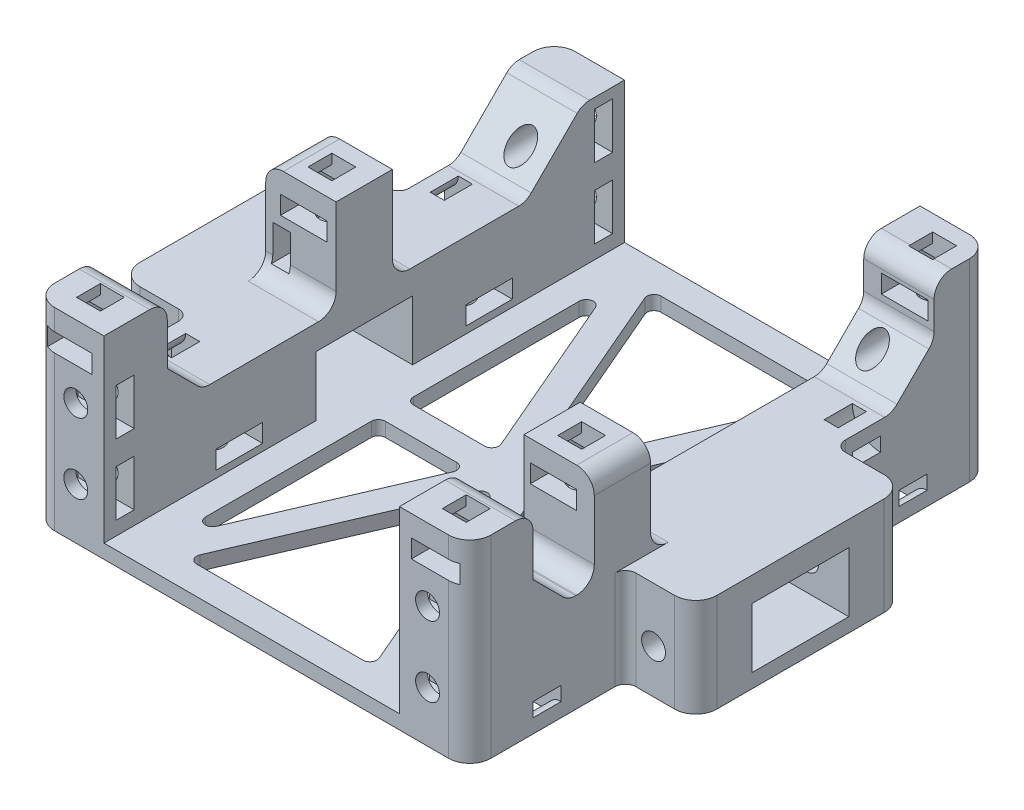
from build123d import *

# Parameters (mm, degrees)
SKETCH1_W                = 75
SKETCH1_H                = 74
BOSS_EXTRUDE1_DEPTH      = 4
BOSS_EXTRUDE2_DEPTH      = 10
SKETCH4_W                = 21
SKETCH4_H                = 37
CUT_EXTRUDE1_DEPTH       = 2
SKETCH6_R                = 1.7
CUT_EXTRUDE2_DEPTH       = 13
SKETCH8_W                = 2.6
SKETCH8_H                = 6.6
CUT_EXTRUDE4_DEPTH       = 8
MIRROR2_COPY_1_DEPTH     = 10
MIRROR2_COPY_2_SKETCH_W  = 21
MIRROR2_COPY_2_SKETCH_H  = 37
MIRROR2_COPY_2_DEPTH     = 2
BOSS_EXTRUDE3_DEPTH      = 10
BOSS_EXTRUDE3_DEPTH_BACK = 4
SKETCH10_W               = 10
SKETCH10_H               = 8
BOSS_EXTRUDE4_DEPTH      = 27.5
MIRROR4_COPY_1_SKETCH_R  = 1.7
MIRROR4_COPY_1_DEPTH     = 13
MIRROR4_COPY_2_SKETCH_W  = 2.6
MIRROR4_COPY_2_SKETCH_H  = 6.6
MIRROR4_COPY_2_DEPTH     = 8
SKETCH11_R               = 1.7
CUT_EXTRUDE5_DEPTH       = 7
CUT_EXTRUDE6_DEPTH       = 5
CUT_EXTRUDE6_DEPTH_BACK  = 8
SKETCH12_W               = 6.6
SKETCH12_H               = 2.6
SKETCH13_W               = 6.6
SKETCH13_H               = 2.6
CUT_EXTRUDE7_DEPTH       = 8
SKETCH14_W               = 6.6
SKETCH14_H               = 2.6
CUT_EXTRUDE8_DEPTH       = 8
BOSS_EXTRUDE5_DEPTH      = 6
BOSS_EXTRUDE6_DEPTH      = 6
CUT_EXTRUDE9_DEPTH       = 60.426425099
CUT_EXTRUDE9_DEPTH_BACK  = 60.426425099
SKETCH15_W               = 13.75
SKETCH15_H               = 8.5
CUT_EXTRUDE10_DEPTH      = 60.426425099
CUT_EXTRUDE10_DEPTH_BACK = 60.426425099
SKETCH18_W               = 5.5
SKETCH18_H               = 4
SKETCH18_W_2             = 7.5
SKETCH19_R               = 1.7
CUT_EXTRUDE11_DEPTH      = 8
SKETCH20_W               = 6.6
SKETCH20_H               = 2.6
CUT_EXTRUDE12_DEPTH      = 8
BOSS_EXTRUDE7_DEPTH      = 10
SKETCH23_R               = 1.7
CUT_EXTRUDE14_DEPTH      = 72.044110417
SKETCH22_W               = 7
SKETCH22_H               = 3
CUT_EXTRUDE13_DEPTH      = 11
CUT_EXTRUDE15_REACH      = 63.508
BOSS_EXTRUDE8_START      = -32
BOSS_EXTRUDE8_DEPTH      = 10
CUT_EXTRUDE16_REACH      = 91.422
SKETCH26_W               = 6.6
SKETCH26_H               = 2.6
SKETCH27_R               = 1.7
CUT_EXTRUDE17_DEPTH      = 7
CUT_EXTRUDE19_REACH      = 66.817
SKETCH29_W               = 2.5
SKETCH29_H               = 5
FILLET1_R                = 1
FILLET2_R                = 3
FILLET3_R                = 1.5
FILLET4_R                = 2.5
SKETCH28_W               = 3.4
SKETCH28_H               = 3.4
CUT_EXTRUDE18_DEPTH      = 5.6
CHAMFER1_SIZE            = 1.6
SKETCH30_W               = 2
SKETCH30_H               = 4
SKETCH31_W               = 4
SKETCH31_H               = 2
SKETCH33_W               = 4
SKETCH33_H               = 2
MIRROR8_COPY_1_SKETCH_W  = 2
MIRROR8_COPY_1_SKETCH_H  = 4


# Read off the part's stored shape, not the designer's step: Boss-Extrude8
# Some blends are built 0.0001 mm under size
with BuildPart() as part:
    # Sketch1 → Boss-Extrude1 (new body)
    with BuildSketch(Plane(origin=(0, 0, 0), x_dir=(1, 0, 0), z_dir=(0, 1, 0))):
        Rectangle(SKETCH1_W, SKETCH1_H)
    extrude(amount=BOSS_EXTRUDE1_DEPTH)

    # Sketch2 → Boss-Extrude2 (add)
    with BuildSketch(Plane(origin=(20, 0, 0), x_dir=(0, 0, -1), z_dir=(1, 0, 0))):
        Polygon((-37, 4), (-37, 22), (-31, 22), (-13, 4), align=None)
    boss_extrude2 = extrude(amount=BOSS_EXTRUDE2_DEPTH)

    # Sketch4 → Cut-Extrude1 (cut)
    with BuildSketch(Plane(origin=(0, 4, 0), x_dir=(1, 0, 0), z_dir=(0, 1, 0))):
        with Locations((9.5, -18.5)):
            Rectangle(SKETCH4_W, SKETCH4_H)
    cut_extrude1 = extrude(amount=-CUT_EXTRUDE1_DEPTH, mode=Mode.SUBTRACT)

    # Sketch6 → Cut-Extrude2 (cut)
    with BuildSketch(Plane.XY.offset(37)):
        with Locations((24, 7.25)):
            Circle(SKETCH6_R)
        with Locations((24, 17.25)):
            Circle(SKETCH6_R)
    cut_extrude2 = extrude(amount=-CUT_EXTRUDE2_DEPTH, mode=Mode.SUBTRACT)

    # Sketch8 → Cut-Extrude4 (cut)
    with BuildSketch(Plane.ZY.offset(-20)):
        with Locations((34, 17.25)):
            Rectangle(SKETCH8_W, SKETCH8_H)
        with Locations((34, 7.25)):
            Rectangle(SKETCH8_W, SKETCH8_H)
    cut_extrude4 = extrude(amount=-CUT_EXTRUDE4_DEPTH, mode=Mode.SUBTRACT)

    # Mirror1: Boss-Extrude2, Cut-Extrude1 across plane
    add(boss_extrude2.mirror(Plane(origin=(-1, 0, 0), x_dir=(0, 0, 1), z_dir=(1, 0, 0))))
    add(cut_extrude1.mirror(Plane(origin=(-1, 0, 0), x_dir=(0, 0, 1), z_dir=(1, 0, 0))), mode=Mode.SUBTRACT)

    # Mirror2: Boss-Extrude2, Cut-Extrude1 across plane
    add(boss_extrude2.mirror(Plane.XY))
    add(cut_extrude1.mirror(Plane.XY), mode=Mode.SUBTRACT)

    # Mirror2 copy 1 sketch → Mirror2 copy 1 (add)
    with BuildSketch(Plane.ZY.offset(22)):
        Polygon((-37, 4), (-37, 22), (-31, 22), (-13, 4), align=None)
    extrude(amount=MIRROR2_COPY_1_DEPTH)

    # Mirror2 copy 2 sketch → Mirror2 copy 2 (cut)
    with BuildSketch(Plane(origin=(-2, 4, 0), x_dir=(-1, 0, 0), z_dir=(0, 1, 0))):
        with Locations((9.5, -18.5)):
            Rectangle(MIRROR2_COPY_2_SKETCH_W, MIRROR2_COPY_2_SKETCH_H)
    extrude(amount=-MIRROR2_COPY_2_DEPTH, mode=Mode.SUBTRACT)

    # Sketch9 → Boss-Extrude3 (add, two sides: drawn at the far end of the back side and taken through both)
    with BuildSketch(Plane(origin=(0, 4, 0), x_dir=(1, 0, 0), z_dir=(0, 1, 0)).offset(-BOSS_EXTRUDE3_DEPTH_BACK)):
        Polygon((-22, -23), (-22, -2), (-22, 2), (-22, 23), (-26, 23), (-26, -23), align=None)
        Polygon((24, 2), (24, 23), (20, 23), (20, 2), (20, -2), (20, -23), (24, -23), (24, -2), align=None)
    extrude(amount=BOSS_EXTRUDE3_DEPTH + BOSS_EXTRUDE3_DEPTH_BACK)

    # Sketch10 → Boss-Extrude4 (add)
    with BuildSketch(Plane(origin=(0, 0, 0), x_dir=(-1, 0, 0), z_dir=(0, -1, 0))):
        Polygon((31.2, 4), (22, 4), (22, -4), (31.2, -4), (32, -4), (32, 4), align=None)
        with Locations((-25, -15.3)):
            Rectangle(SKETCH10_W, SKETCH10_H)
        with Locations((-25, 33)):
            Rectangle(SKETCH10_W, SKETCH10_H)
    extrude(amount=-BOSS_EXTRUDE4_DEPTH)

    # Mirror3: Cut-Extrude2, Cut-Extrude4 across plane
    add(cut_extrude2.mirror(Plane(origin=(-1, 0, 0), x_dir=(0, 0, 1), z_dir=(1, 0, 0))), mode=Mode.SUBTRACT)
    add(cut_extrude4.mirror(Plane(origin=(-1, 0, 0), x_dir=(0, 0, 1), z_dir=(1, 0, 0))), mode=Mode.SUBTRACT)

    # Mirror4: Cut-Extrude2, Cut-Extrude4 across plane
    add(cut_extrude2.mirror(Plane.XY), mode=Mode.SUBTRACT)
    add(cut_extrude4.mirror(Plane.XY), mode=Mode.SUBTRACT)

    # Mirror4 copy 1 sketch → Mirror4 copy 1 (cut)
    with BuildSketch(Plane(origin=(-2, 0, -37), x_dir=(-1, 0, 0), z_dir=(0, 0, -1))):
        with Locations((24, 7.25)):
            Circle(MIRROR4_COPY_1_SKETCH_R)
        with Locations((24, 17.25)):
            Circle(MIRROR4_COPY_1_SKETCH_R)
    extrude(amount=-MIRROR4_COPY_1_DEPTH, mode=Mode.SUBTRACT)

    # Mirror4 copy 2 sketch → Mirror4 copy 2 (cut)
    with BuildSketch(Plane(origin=(-22, 0, 0), x_dir=(0, 0, -1), z_dir=(1, 0, 0))):
        with Locations((34, 17.25)):
            Rectangle(MIRROR4_COPY_2_SKETCH_W, MIRROR4_COPY_2_SKETCH_H)
        with Locations((34, 7.25)):
            Rectangle(MIRROR4_COPY_2_SKETCH_W, MIRROR4_COPY_2_SKETCH_H)
    extrude(amount=-MIRROR4_COPY_2_DEPTH, mode=Mode.SUBTRACT)

    # Sketch11 → Cut-Extrude5 (cut)
    with BuildSketch(Plane(origin=(0, 27.5, 0), x_dir=(1, 0, 0), z_dir=(0, 1, 0))):
        with Locations(Location((-26.6, 0, 0), (0, 0, 270))):
            Circle(SKETCH11_R)
        with Locations(Location((25.8, 33, 0), (0, 0, 270))):
            Circle(SKETCH11_R)
        with Locations(Location((24.2, -15.3, 0), (0, 0, 270))):
            Circle(SKETCH11_R)
    extrude(amount=-CUT_EXTRUDE5_DEPTH, mode=Mode.SUBTRACT)

    # Sketch12 → Cut-Extrude6 (cut, two sides: drawn at the far end of the back side and taken through both)
    with BuildSketch(Plane.XY.offset(-29).offset(-CUT_EXTRUDE6_DEPTH_BACK)):
        with Locations((25.8, 23.2)):
            Rectangle(SKETCH12_W, SKETCH12_H)
    extrude(amount=CUT_EXTRUDE6_DEPTH + CUT_EXTRUDE6_DEPTH_BACK, mode=Mode.SUBTRACT)

    # Sketch13 → Cut-Extrude7 (cut)
    with BuildSketch(Plane(origin=(0, 0, 11.3), x_dir=(-1, 0, 0), z_dir=(0, 0, -1))):
        with Locations((-24.2, 23.2)):
            Rectangle(SKETCH13_W, SKETCH13_H)
    extrude(amount=-CUT_EXTRUDE7_DEPTH, mode=Mode.SUBTRACT)

    # Sketch14 → Cut-Extrude8 (cut)
    with BuildSketch(Plane(origin=(0, 0, -4), x_dir=(-1, 0, 0), z_dir=(0, 0, -1))):
        with Locations((26.6, 23.2)):
            Rectangle(SKETCH14_W, SKETCH14_H)
    extrude(amount=-CUT_EXTRUDE8_DEPTH, mode=Mode.SUBTRACT)

    # Sketch16 → Boss-Extrude5 (add)
    with BuildSketch(Plane.ZY.offset(26)):
        Polygon((-23, 14), (-13, 4), (13, 4), (23, 14), align=None)
    extrude(amount=BOSS_EXTRUDE5_DEPTH)

    # Sketch17 → Boss-Extrude6 (add)
    with BuildSketch(Plane(origin=(24, 0, 0), x_dir=(0, 0, -1), z_dir=(1, 0, 0))):
        Polygon((-23, 14), (-13, 4), (13, 4), (23, 14), align=None)
    extrude(amount=BOSS_EXTRUDE6_DEPTH)

    # Sketch15 → Cut-Extrude9 (cut, two sides: drawn at the far end of the back side and taken through both)
    with BuildSketch(Plane(origin=(0, 0, 0), x_dir=(0, 0, -1), z_dir=(1, 0, 0)).offset(-CUT_EXTRUDE9_DEPTH_BACK)):
        with Locations((0, 6.25)):
            Rectangle(SKETCH15_W, SKETCH15_H)
    extrude(amount=CUT_EXTRUDE9_DEPTH + CUT_EXTRUDE9_DEPTH_BACK, mode=Mode.SUBTRACT)

    # Sketch18 → Cut-Extrude10 (cut, two sides: drawn at the far end of the back side and taken through both)
    with BuildSketch(Plane.XY.offset(-CUT_EXTRUDE10_DEPTH_BACK)):
        with Locations((-34.75, 2)):
            Rectangle(SKETCH18_W, SKETCH18_H)
        with Locations((33.75, 2)):
            Rectangle(SKETCH18_W_2, SKETCH18_H)
    extrude(amount=CUT_EXTRUDE10_DEPTH + CUT_EXTRUDE10_DEPTH_BACK, mode=Mode.SUBTRACT)

    # Sketch19 → Cut-Extrude11 (cut)
    with BuildSketch(Plane.XZ):
        with Locations(Location((-26, 17.75, 0), (0, 0, 270))):
            Circle(SKETCH19_R)
        with Locations(Location((-26, -17.75, 0), (0, 0, 90))):
            Circle(SKETCH19_R)
    extrude(amount=-CUT_EXTRUDE11_DEPTH, mode=Mode.SUBTRACT)

    # Sketch20 → Cut-Extrude12 (cut)
    with BuildSketch(Plane(origin=(-22, 0, 0), x_dir=(0, 0, -1), z_dir=(1, 0, 0))):
        with Locations((-17.75, 4.3)):
            Rectangle(SKETCH20_W, SKETCH20_H)
        with Locations((17.75, 4.3)):
            Rectangle(SKETCH20_W, SKETCH20_H)
    extrude(amount=-CUT_EXTRUDE12_DEPTH, mode=Mode.SUBTRACT)

    # Sketch21 → Boss-Extrude7 (add)
    with BuildSketch(Plane(origin=(30, 0, 0), x_dir=(0, 0, -1), z_dir=(1, 0, 0))):
        Polygon((-14.875, 0), (0, 0), (0, 2), (-6.875, 2), (-6.875, 10.5), (0, 10.5), (0, 14), (-11.3, 14), (-14.875, 14), align=None)
        Polygon((0, 2), (0, 0), (14.875, 0), (14.875, 14), (11.3, 14), (0, 14), (0, 10.5), (6.875, 10.5), (6.875, 2), align=None)
    boss_extrude7 = extrude(amount=BOSS_EXTRUDE7_DEPTH)

    # Sketch23 → Cut-Extrude14 (cut, through all)
    with BuildSketch(Plane(origin=(0, 0, -14.875), x_dir=(-1, 0, 0), z_dir=(0, 0, -1))):
        with Locations(Location((-34, 6.25, 0), (0, 0, 90))):
            Circle(SKETCH23_R)
    cut_extrude14 = extrude(amount=-CUT_EXTRUDE14_DEPTH, mode=Mode.SUBTRACT)

    # Sketch22 → Cut-Extrude13 (cut)
    with BuildSketch(Plane.XZ):
        with Locations((34, 10.875)):
            Rectangle(SKETCH22_W, SKETCH22_H)
        with Locations((34, -10.875)):
            Rectangle(SKETCH22_W, SKETCH22_H)
    cut_extrude13 = extrude(amount=-CUT_EXTRUDE13_DEPTH, mode=Mode.SUBTRACT)

    # Mirror5: Boss-Extrude7, Cut-Extrude14, Cut-Extrude13 across plane
    add(boss_extrude7.mirror(Plane(origin=(-1, 0, 0), x_dir=(0, 0, 1), z_dir=(1, 0, 0))))
    add(cut_extrude14.mirror(Plane(origin=(-1, 0, 0), x_dir=(0, 0, 1), z_dir=(1, 0, 0))), mode=Mode.SUBTRACT)
    add(cut_extrude13.mirror(Plane(origin=(-1, 0, 0), x_dir=(0, 0, 1), z_dir=(1, 0, 0))), mode=Mode.SUBTRACT)

    # Sketch24 → Cut-Extrude15 (cut, up to next)
    with BuildSketch(Plane(origin=(0, 2, 0), x_dir=(1, 0, 0), z_dir=(0, 1, 0)), mode=Mode.PRIVATE) as cut_extrude15_sk1:
        Polygon((-18, 2), (-18, 31.420377933), (-5.353875425, 2), align=None)
    cut_extrude15_tool1 = extrude(cut_extrude15_sk1.sketch, amount=-CUT_EXTRUDE15_REACH, mode=Mode.PRIVATE) & part.part
    # Sketch24 → Cut-Extrude15 (cut, up to next)
    with BuildSketch(Plane(origin=(0, 2, 0), x_dir=(1, 0, 0), z_dir=(0, 1, 0)), mode=Mode.PRIVATE) as cut_extrude15_sk2:
        Polygon((-14.325113046, 33), (-1, 2), (12.325113046, 33), align=None)
    cut_extrude15_tool2 = extrude(cut_extrude15_sk2.sketch, amount=-CUT_EXTRUDE15_REACH, mode=Mode.PRIVATE) & part.part
    # Sketch24 → Cut-Extrude15 (cut, up to next)
    with BuildSketch(Plane(origin=(0, 2, 0), x_dir=(1, 0, 0), z_dir=(0, 1, 0)), mode=Mode.PRIVATE) as cut_extrude15_sk3:
        Polygon((16, 2), (3.353875425, 2), (16, 31.420377933), align=None)
    cut_extrude15_tool3 = extrude(cut_extrude15_sk3.sketch, amount=-CUT_EXTRUDE15_REACH, mode=Mode.PRIVATE) & part.part
    # Sketch24 → Cut-Extrude15 (cut, up to next)
    with BuildSketch(Plane(origin=(0, 2, 0), x_dir=(1, 0, 0), z_dir=(0, 1, 0)), mode=Mode.PRIVATE) as cut_extrude15_sk4:
        Polygon((16, -2), (16, -31.420377933), (3.353875425, -2), align=None)
    cut_extrude15_tool4 = extrude(cut_extrude15_sk4.sketch, amount=-CUT_EXTRUDE15_REACH, mode=Mode.PRIVATE) & part.part
    # Sketch24 → Cut-Extrude15 (cut, up to next)
    with BuildSketch(Plane(origin=(0, 2, 0), x_dir=(1, 0, 0), z_dir=(0, 1, 0)), mode=Mode.PRIVATE) as cut_extrude15_sk5:
        Polygon((12.325113046, -33), (-1, -2), (-14.325113046, -33), align=None)
    cut_extrude15_tool5 = extrude(cut_extrude15_sk5.sketch, amount=-CUT_EXTRUDE15_REACH, mode=Mode.PRIVATE) & part.part
    # Sketch24 → Cut-Extrude15 (cut, up to next)
    with BuildSketch(Plane(origin=(0, 2, 0), x_dir=(1, 0, 0), z_dir=(0, 1, 0)), mode=Mode.PRIVATE) as cut_extrude15_sk6:
        Polygon((-18, -2), (-5.353875425, -2), (-18, -31.420377933), align=None)
    cut_extrude15_tool6 = extrude(cut_extrude15_sk6.sketch, amount=-CUT_EXTRUDE15_REACH, mode=Mode.PRIVATE) & part.part
    add(cut_extrude15_tool1.solids().sort_by_distance((-13.784625, 2, -11.806793))[0], mode=Mode.SUBTRACT)
    add(cut_extrude15_tool2.solids().sort_by_distance((-1, 2, -22.666667))[0], mode=Mode.SUBTRACT)
    add(cut_extrude15_tool3.solids().sort_by_distance((11.784625, 2, -11.806793))[0], mode=Mode.SUBTRACT)
    add(cut_extrude15_tool4.solids().sort_by_distance((11.784625, 2, 11.806793))[0], mode=Mode.SUBTRACT)
    add(cut_extrude15_tool5.solids().sort_by_distance((-1, 2, 22.666667))[0], mode=Mode.SUBTRACT)
    add(cut_extrude15_tool6.solids().sort_by_distance((-13.784625, 2, 11.806793))[0], mode=Mode.SUBTRACT)

    # Boss-Extrude8 outline → Boss-Extrude8 (add)
    with BuildSketch(Plane.YZ.offset(BOSS_EXTRUDE8_START)):
        Polygon((27.5, 37), (22, 37), (22, 31), (19, 28), (27.5, 28), align=None)
    boss_extrude8 = extrude(amount=BOSS_EXTRUDE8_DEPTH)

    # Sketch26 → Cut-Extrude16 (cut, up to next)
    with BuildSketch(Plane.XY.offset(37), mode=Mode.PRIVATE) as cut_extrude16_sk1:
        with Locations((-27, 23.2)):
            Rectangle(SKETCH26_W, SKETCH26_H)
    cut_extrude16_tool1 = extrude(cut_extrude16_sk1.sketch, amount=-CUT_EXTRUDE16_REACH, mode=Mode.PRIVATE) & part.part
    cut_extrude16 = cut_extrude16_tool1.solids().sort_by_distance((-27, 23.2, 37))[0]
    add(cut_extrude16, mode=Mode.SUBTRACT)

    # Sketch27 → Cut-Extrude17 (cut)
    with BuildSketch(Plane(origin=(0, 27.5, 0), x_dir=(1, 0, 0), z_dir=(0, 1, 0))):
        with Locations(Location((-27, -32.5, 0), (0, 0, 186.756327031))):
            Circle(SKETCH27_R)
    cut_extrude17 = extrude(amount=-CUT_EXTRUDE17_DEPTH, mode=Mode.SUBTRACT)

    # Mirror6: Boss-Extrude8, Cut-Extrude16, Cut-Extrude17 across plane
    add(boss_extrude8.mirror(Plane(origin=(-1, 0, 0), x_dir=(0, 0, 1), z_dir=(1, 0, 0))))
    add(cut_extrude16.mirror(Plane(origin=(-1, 0, 0), x_dir=(0, 0, 1), z_dir=(1, 0, 0))), mode=Mode.SUBTRACT)
    add(cut_extrude17.mirror(Plane(origin=(-1, 0, 0), x_dir=(0, 0, 1), z_dir=(1, 0, 0))), mode=Mode.SUBTRACT)

    # Sketch29 → Cut-Extrude19 (cut, up to next)
    with BuildSketch(Plane.XY.offset(4), mode=Mode.PRIVATE) as cut_extrude19_sk1:
        with Locations((-29.75, 18)):
            Rectangle(SKETCH29_W, SKETCH29_H)
    cut_extrude19_tool1 = extrude(cut_extrude19_sk1.sketch, amount=-CUT_EXTRUDE19_REACH, mode=Mode.PRIVATE) & part.part
    add(cut_extrude19_tool1.solids().sort_by_distance((-29.75, 18, 4))[0], mode=Mode.SUBTRACT)

    # Fillet1
    fillet1_edges = [part.edges().sort_by_distance(p)[0] for p in [
        (3.353875425, 1, 2),
        (16, 1, 2),
        (16, 1, 31.420377933),
        (-5.353875425, 1, -2),
        (-18, 1, -2),
        (-18, 1, -31.420377933),
        (-14.325113046, 1, -33),
        (12.325113046, 1, -33),
        (-1, 1, -2),
        (16, 1, -31.420377933),
        (16, 1, -2),
        (3.353875425, 1, -2),
        (-18, 1, 31.420377933),
        (-18, 1, 2),
        (-5.353875425, 1, 2),
        (-14.325113046, 1, 33),
        (-1, 1, 2),
        (12.325113046, 1, 33),
    ]]
    fillet(fillet1_edges, radius=FILLET1_R)

    # Fillet2
    # the kernel refuses this fillet: 3 mm, written as the material it takes off along each edge
    with BuildSketch(Plane(origin=(-32, -7.5, -37), x_dir=(0, 0, 1), z_dir=(0, 1, 0))) as fillet2_piece_1:
        with BuildLine():
            CenterArc((FILLET2_R, FILLET2_R), FILLET2_R, 180, 90)
            Line((0, FILLET2_R), (0, 0))
            Line((0, 0), (FILLET2_R, 0))
        make_face()
    extrude(amount=37, mode=Mode.SUBTRACT)
    with BuildSketch(Plane(origin=(30, 35, -37), x_dir=(0, 0, 1), z_dir=(0, -1, 0))) as fillet2_piece_2:
        with BuildLine():
            CenterArc((FILLET2_R, FILLET2_R), FILLET2_R, 180, 90)
            Line((0, FILLET2_R), (0, 0))
            Line((0, 0), (FILLET2_R, 0))
        make_face()
    extrude(amount=42.5, mode=Mode.SUBTRACT)
    with BuildSketch(Plane(origin=(30, -7.5, 37), x_dir=(-1, 0, 0), z_dir=(0, 1, 0)), Plane(origin=(-32, 35, 37), x_dir=(1, 0, 0), z_dir=(0, -1, 0))) as fillet2_piece_3:
        with BuildLine():
            CenterArc((FILLET2_R, -FILLET2_R), FILLET2_R, 90, 90)
            Line((0, -FILLET2_R), (0, 0))
            Line((0, 0), (FILLET2_R, 0))
        make_face()
    extrude(amount=42.5, mode=Mode.SUBTRACT)
    with BuildSketch(Plane(origin=(40, -7.5, -14.875), x_dir=(0, 0, 1), z_dir=(0, 1, 0)), Plane(origin=(-42, 21.5, 14.875), x_dir=(1, 0, 0), z_dir=(0, -1, 0))) as fillet2_piece_4:
        with BuildLine():
            CenterArc((FILLET2_R, -FILLET2_R), FILLET2_R, 90, 90)
            Line((0, -FILLET2_R), (0, 0))
            Line((0, 0), (FILLET2_R, 0))
        make_face()
    extrude(amount=29, mode=Mode.SUBTRACT)
    with BuildSketch(Plane(origin=(40, 21.5, 14.875), x_dir=(-1, 0, 0), z_dir=(0, -1, 0)), Plane(origin=(-42, -7.5, -14.875), x_dir=(0, 0, 1), z_dir=(0, 1, 0))) as fillet2_piece_5:
        with BuildLine():
            CenterArc((FILLET2_R, FILLET2_R), FILLET2_R, 180, 90)
            Line((0, FILLET2_R), (0, 0))
            Line((0, 0), (FILLET2_R, 0))
        make_face()
    extrude(amount=29, mode=Mode.SUBTRACT)

    # Fillet3
    fillet3_edges = [part.edges().sort_by_distance(p)[0] for p in [
        (30, 7, 14.875),
        (30, 7, -14.875),
        (-32, 7, -14.875),
        (-32, 7, 14.875),
    ]]
    fillet(fillet3_edges, radius=FILLET3_R)

    # Fillet4
    # the kernel refuses this fillet: 2.5 mm, written as the material it adds along each edge
    with BuildSketch(Plane(origin=(-22, 14, 23), x_dir=(0, 0.707106781186539, 0.7071067811865562), z_dir=(-1, 0, 0)), Plane(origin=(30, 14, 23), x_dir=(-1.507288760336418e-15, 0.707106781186551, 0.7071067811865441), z_dir=(-1, 0, 0))) as fillet4_piece_1:
        with BuildLine():
            CenterArc((FILLET4_R * 0.414213562373, FILLET4_R), FILLET4_R, 225, 45)
            Line((-FILLET4_R * 0.292893218813, FILLET4_R * 0.292893218813), (0, 0))
            Line((0, 0), (FILLET4_R * 0.414213562373, 0))
        make_face()
    extrude(amount=10)
    with BuildSketch(Plane(origin=(-32, 14, -23), x_dir=(0, 0, 1), z_dir=(1, 0, 0)), Plane(origin=(20, 14, -23), x_dir=(0, 0, 1), z_dir=(1, 0, 0)), Plane(origin=(20, 20, -29), x_dir=(0, -0.7071067811865476, 0.7071067811865476), z_dir=(1, 0, 0))) as fillet4_piece_2:
        with BuildLine():
            CenterArc((FILLET4_R * 0.414213562373, -FILLET4_R), FILLET4_R, 90, 45)
            Line((-FILLET4_R * 0.292893218813, -FILLET4_R * 0.292893218813), (0, 0))
            Line((0, 0), (FILLET4_R * 0.414213562373, 0))
        make_face()
    extrude(amount=10)
    with BuildSketch(Plane(origin=(-22, 14, 4), x_dir=(0, 1, 0), z_dir=(-1, 0, 0))) as fillet4_piece_3_section:
        with BuildLine():
            CenterArc((FILLET4_R, -FILLET4_R), FILLET4_R, 90, 90)
            Line((0, -FILLET4_R), (0, 0))
            Line((0, 0), (FILLET4_R, 0))
        make_face()
    fillet4_piece_3 = extrude(amount=10, mode=Mode.PRIVATE)
    fillet4_piece_3 = split(fillet4_piece_3, bisect_by=Plane(origin=(-25.25, 15.5, 4.02532962), z_dir=(0, 1, 0)), keep=Keep.TOP, mode=Mode.PRIVATE)
    fillet4_piece_3 = split(fillet4_piece_3, bisect_by=Plane(origin=(-28.5, 15.854371665, 4.02532962), z_dir=(1, 0, 0)), keep=Keep.TOP, mode=Mode.PRIVATE)
    add(fillet4_piece_3)
    with BuildSketch(Plane(origin=(-22, 14, 4), x_dir=(0, 1, 0), z_dir=(-1, 0, 0))) as fillet4_piece_4_section:
        with BuildLine():
            CenterArc((FILLET4_R, -FILLET4_R), FILLET4_R, 90, 90)
            Line((0, -FILLET4_R), (0, 0))
            Line((0, 0), (FILLET4_R, 0))
        make_face()
    fillet4_piece_4 = extrude(amount=10, mode=Mode.PRIVATE)
    fillet4_piece_4 = split(fillet4_piece_4, bisect_by=Plane(origin=(-25.25, 15.5, 4.609362939), z_dir=(0, -1, 0)), keep=Keep.TOP, mode=Mode.PRIVATE)
    fillet4_piece_4 = split(fillet4_piece_4, bisect_by=Plane(origin=(-28.5, 14.462625159, 4.609362939), z_dir=(1, 0, 0)), keep=Keep.TOP, mode=Mode.PRIVATE)
    add(fillet4_piece_4)
    with BuildSketch(Plane(origin=(-22, 14, 4), x_dir=(0, 1, 0), z_dir=(-1, 0, 0))) as fillet4_piece_5_section:
        with BuildLine():
            CenterArc((FILLET4_R, -FILLET4_R), FILLET4_R, 90, 90)
            Line((0, -FILLET4_R), (0, 0))
            Line((0, 0), (FILLET4_R, 0))
        make_face()
    fillet4_piece_5 = extrude(amount=10, mode=Mode.PRIVATE)
    fillet4_piece_5 = split(fillet4_piece_5, bisect_by=Plane(origin=(-29.75, 15.5, 4.609362939), z_dir=(0, -1, 0)), keep=Keep.TOP, mode=Mode.PRIVATE)
    fillet4_piece_5 = split(fillet4_piece_5, bisect_by=Plane(origin=(-28.5, 14.462625159, 4.609362939), z_dir=(-1, 0, 0)), keep=Keep.TOP, mode=Mode.PRIVATE)
    fillet4_piece_5 = split(fillet4_piece_5, bisect_by=Plane(origin=(-31, 14.462625159, 4.609362939), z_dir=(1, 0, 0)), keep=Keep.TOP, mode=Mode.PRIVATE)
    add(fillet4_piece_5)
    with BuildSketch(Plane(origin=(-22, 14, 4), x_dir=(0, 1, 0), z_dir=(-1, 0, 0))) as fillet4_piece_6_section:
        with BuildLine():
            CenterArc((FILLET4_R, -FILLET4_R), FILLET4_R, 90, 90)
            Line((0, -FILLET4_R), (0, 0))
            Line((0, 0), (FILLET4_R, 0))
        make_face()
    fillet4_piece_6 = extrude(amount=10, mode=Mode.PRIVATE)
    fillet4_piece_6 = split(fillet4_piece_6, bisect_by=Plane(origin=(-31.5, 15.5, 4.02532962), z_dir=(0, 1, 0)), keep=Keep.TOP, mode=Mode.PRIVATE)
    fillet4_piece_6 = split(fillet4_piece_6, bisect_by=Plane(origin=(-31, 15.854371665, 4.02532962), z_dir=(-1, 0, 0)), keep=Keep.TOP, mode=Mode.PRIVATE)
    add(fillet4_piece_6)
    with BuildSketch(Plane(origin=(-22, 14, 4), x_dir=(0, 1, 0), z_dir=(-1, 0, 0))) as fillet4_piece_7_section:
        with BuildLine():
            CenterArc((FILLET4_R, -FILLET4_R), FILLET4_R, 90, 90)
            Line((0, -FILLET4_R), (0, 0))
            Line((0, 0), (FILLET4_R, 0))
        make_face()
    fillet4_piece_7 = extrude(amount=10, mode=Mode.PRIVATE)
    fillet4_piece_7 = split(fillet4_piece_7, bisect_by=Plane(origin=(-31.5, 15.5, 4.609362939), z_dir=(0, -1, 0)), keep=Keep.TOP, mode=Mode.PRIVATE)
    fillet4_piece_7 = split(fillet4_piece_7, bisect_by=Plane(origin=(-31, 14.462625159, 4.609362939), z_dir=(-1, 0, 0)), keep=Keep.TOP, mode=Mode.PRIVATE)
    add(fillet4_piece_7)
    with BuildSketch(Plane(origin=(-32, 14, -4), x_dir=(0, 1, 0), z_dir=(1, 0, 0))) as fillet4_piece_8_section:
        with BuildLine():
            CenterArc((FILLET4_R, -FILLET4_R), FILLET4_R, 90, 90)
            Line((0, -FILLET4_R), (0, 0))
            Line((0, 0), (FILLET4_R, 0))
        make_face()
    fillet4_piece_8 = extrude(amount=10, mode=Mode.PRIVATE)
    fillet4_piece_8 = split(fillet4_piece_8, bisect_by=Plane(origin=(-31, 15.854371665, -4.02532962), z_dir=(-1, 0, 0)), keep=Keep.TOP, mode=Mode.PRIVATE)
    fillet4_piece_8 = split(fillet4_piece_8, bisect_by=Plane(origin=(-31.5, 15.5, -4.02532962), z_dir=(0, 1, 0)), keep=Keep.TOP, mode=Mode.PRIVATE)
    add(fillet4_piece_8)
    with BuildSketch(Plane(origin=(-32, 14, -4), x_dir=(0, 1, 0), z_dir=(1, 0, 0))) as fillet4_piece_9_section:
        with BuildLine():
            CenterArc((FILLET4_R, -FILLET4_R), FILLET4_R, 90, 90)
            Line((0, -FILLET4_R), (0, 0))
            Line((0, 0), (FILLET4_R, 0))
        make_face()
    fillet4_piece_9 = extrude(amount=10, mode=Mode.PRIVATE)
    fillet4_piece_9 = split(fillet4_piece_9, bisect_by=Plane(origin=(-31, 14.462625159, -4.609362939), z_dir=(-1, 0, 0)), keep=Keep.TOP, mode=Mode.PRIVATE)
    fillet4_piece_9 = split(fillet4_piece_9, bisect_by=Plane(origin=(-31.5, 15.5, -4.609362939), z_dir=(0, -1, 0)), keep=Keep.TOP, mode=Mode.PRIVATE)
    add(fillet4_piece_9)
    with BuildSketch(Plane(origin=(-32, 14, -4), x_dir=(0, 1, 0), z_dir=(1, 0, 0))) as fillet4_piece_10_section:
        with BuildLine():
            CenterArc((FILLET4_R, -FILLET4_R), FILLET4_R, 90, 90)
            Line((0, -FILLET4_R), (0, 0))
            Line((0, 0), (FILLET4_R, 0))
        make_face()
    fillet4_piece_10 = extrude(amount=10, mode=Mode.PRIVATE)
    fillet4_piece_10 = split(fillet4_piece_10, bisect_by=Plane(origin=(-31, 14.462625159, -4.609362939), z_dir=(1, 0, 0)), keep=Keep.TOP, mode=Mode.PRIVATE)
    fillet4_piece_10 = split(fillet4_piece_10, bisect_by=Plane(origin=(-28.5, 14.462625159, -4.609362939), z_dir=(-1, 0, 0)), keep=Keep.TOP, mode=Mode.PRIVATE)
    fillet4_piece_10 = split(fillet4_piece_10, bisect_by=Plane(origin=(-29.75, 15.5, -4.609362939), z_dir=(0, -1, 0)), keep=Keep.TOP, mode=Mode.PRIVATE)
    add(fillet4_piece_10)
    with BuildSketch(Plane(origin=(-32, 14, -4), x_dir=(0, 1, 0), z_dir=(1, 0, 0))) as fillet4_piece_11_section:
        with BuildLine():
            CenterArc((FILLET4_R, -FILLET4_R), FILLET4_R, 90, 90)
            Line((0, -FILLET4_R), (0, 0))
            Line((0, 0), (FILLET4_R, 0))
        make_face()
    fillet4_piece_11 = extrude(amount=10, mode=Mode.PRIVATE)
    fillet4_piece_11 = split(fillet4_piece_11, bisect_by=Plane(origin=(-28.5, 15.854371665, -4.02532962), z_dir=(1, 0, 0)), keep=Keep.TOP, mode=Mode.PRIVATE)
    fillet4_piece_11 = split(fillet4_piece_11, bisect_by=Plane(origin=(-25.25, 15.5, -4.02532962), z_dir=(0, 1, 0)), keep=Keep.TOP, mode=Mode.PRIVATE)
    add(fillet4_piece_11)
    with BuildSketch(Plane(origin=(-32, 14, -4), x_dir=(0, 1, 0), z_dir=(1, 0, 0))) as fillet4_piece_12_section:
        with BuildLine():
            CenterArc((FILLET4_R, -FILLET4_R), FILLET4_R, 90, 90)
            Line((0, -FILLET4_R), (0, 0))
            Line((0, 0), (FILLET4_R, 0))
        make_face()
    fillet4_piece_12 = extrude(amount=10, mode=Mode.PRIVATE)
    fillet4_piece_12 = split(fillet4_piece_12, bisect_by=Plane(origin=(-28.5, 14.462625159, -4.609362939), z_dir=(1, 0, 0)), keep=Keep.TOP, mode=Mode.PRIVATE)
    fillet4_piece_12 = split(fillet4_piece_12, bisect_by=Plane(origin=(-25.25, 15.5, -4.609362939), z_dir=(0, -1, 0)), keep=Keep.TOP, mode=Mode.PRIVATE)
    add(fillet4_piece_12)
    with BuildSketch(Plane(origin=(20, 14, 11.3), x_dir=(0, 1, 0), z_dir=(1, 0, 0))) as fillet4_piece_13:
        with BuildLine():
            CenterArc((FILLET4_R, -FILLET4_R), FILLET4_R, 90, 90)
            Line((0, -FILLET4_R), (0, 0))
            Line((0, 0), (FILLET4_R, 0))
        make_face()
    extrude(amount=10)
    with BuildSketch(Plane(origin=(30, 14, 19.3), x_dir=(0, 0, 1), z_dir=(-1, 0, 0))) as fillet4_piece_14:
        with BuildLine():
            CenterArc((FILLET4_R, FILLET4_R), FILLET4_R, 180, 90)
            Line((0, FILLET4_R), (0, 0))
            Line((0, 0), (FILLET4_R, 0))
        make_face()
    extrude(amount=10)
    # the kernel refuses this fillet: 2.5 mm, written as the material it takes off along each edge
    with BuildSketch(Plane(origin=(-19.411165235, 22, -31), x_dir=(0, -0.7071067811865492, 0.7071067811865458), z_dir=(-1, 0, 0))) as fillet4_2_piece_1:
        with BuildLine():
            CenterArc((FILLET4_R * 0.414213562373, -FILLET4_R), FILLET4_R, 90, 45)
            Line((-FILLET4_R * 0.292893218813, -FILLET4_R * 0.292893218813), (0, 0))
            Line((0, 0), (FILLET4_R * 0.414213562373, 0))
        make_face()
    extrude(amount=15.17766953, mode=Mode.SUBTRACT)
    with BuildSketch(Plane(origin=(-32, 27.5, 10.25), x_dir=(0, -1, 0), z_dir=(0, 0, -1)), Plane(origin=(30, 27.5, 25.55), x_dir=(-1, 0, 0), z_dir=(0, 0, -1))) as fillet4_2_piece_2:
        with BuildLine():
            CenterArc((FILLET4_R, -FILLET4_R), FILLET4_R, 90, 90)
            Line((0, -FILLET4_R), (0, 0))
            Line((0, 0), (FILLET4_R, 0))
        make_face()
    extrude(amount=20.5, mode=Mode.SUBTRACT)
    with BuildSketch(Plane(origin=(13.75, 27.5, -29), x_dir=(0, -1, 0), z_dir=(1, 0, 0)), Plane(origin=(-38.25, 27.5, 28), x_dir=(0, 0, 1), z_dir=(1, 0, 0))) as fillet4_2_piece_3:
        with BuildLine():
            CenterArc((FILLET4_R, FILLET4_R), FILLET4_R, 180, 90)
            Line((0, FILLET4_R), (0, 0))
            Line((0, 0), (FILLET4_R, 0))
        make_face()
    extrude(amount=22.5, mode=Mode.SUBTRACT)
    with BuildSketch(Plane(origin=(36.25, 27.5, 28), x_dir=(0, 0, 1), z_dir=(-1, 0, 0))) as fillet4_2_piece_4:
        with BuildLine():
            CenterArc((FILLET4_R, -FILLET4_R), FILLET4_R, 90, 90)
            Line((0, -FILLET4_R), (0, 0))
            Line((0, 0), (FILLET4_R, 0))
        make_face()
    extrude(amount=22.5, mode=Mode.SUBTRACT)

    # Sketch28 → Cut-Extrude18 (cut)
    with BuildSketch(Plane(origin=(0, 27.5, 0), x_dir=(1, 0, 0), z_dir=(0, 1, 0))):
        with Locations((-27, -32.5)):
            Rectangle(SKETCH28_W, SKETCH28_H)
        with Locations((25, -32.5)):
            Rectangle(SKETCH28_W, SKETCH28_H)
        with Locations((25.8, 33)):
            Rectangle(SKETCH28_W, SKETCH28_H)
        with Locations((-26.6, 0)):
            Rectangle(SKETCH28_W, SKETCH28_H)
        with Locations((24.2, -15.3)):
            Rectangle(SKETCH28_W, SKETCH28_H)
    extrude(amount=-CUT_EXTRUDE18_DEPTH, mode=Mode.SUBTRACT)

    # Chamfer1
    chamfer1_edges = [part.edges().sort_by_distance(p)[0] for p in [
        (23.3, 24.5, 32.5),
        (26.7, 24.5, 32.5),
        (22.5, 24.5, 15.3),
        (25.9, 24.5, 15.3),
        (27.5, 24.5, -33),
        (24.1, 24.5, -33),
        (-28.7, 24.5, 32.5),
        (-25.3, 24.5, 32.5),
        (-28.3, 24.5, 0),
        (-24.9, 24.5, 0),
    ]]
    chamfer(chamfer1_edges, length=CHAMFER1_SIZE - 0.0001)  # a hair under: the kernel refuses the full size

    # Sketch30 → Cut-Revolve1 (revolve, cut)
    with BuildSketch(Plane.XZ):
        with Locations((27, 26)):
            Rectangle(SKETCH30_W, SKETCH30_H)
    cut_revolve1 = revolve(axis=Axis((30, 0, 16.375), (0, 0, 1)), mode=Mode.SUBTRACT)

    # Sketch31 → Cut-Revolve2 (revolve, cut)
    with BuildSketch(Plane(origin=(30, 0, 0), x_dir=(0, 0, -1), z_dir=(1, 0, 0))):
        with Locations((19.375, 11)):
            Rectangle(SKETCH31_W, SKETCH31_H)
    revolve(axis=Axis((30, 14, -16.375), (0, 0, -1)), mode=Mode.SUBTRACT)

    # Sketch33 → Cut-Revolve3 (revolve, cut)
    with BuildSketch(Plane.ZY.offset(32)):
        with Locations((-19.375, 11)):
            Rectangle(SKETCH33_W, SKETCH33_H)
        with Locations((19.375, 11)):
            Rectangle(SKETCH33_W, SKETCH33_H)
    revolve(axis=Axis((-32, 14, -21.964466094), (0, 0, 1)), mode=Mode.SUBTRACT)

    # Mirror7: Cut-Revolve1 across plane
    add(cut_revolve1.mirror(Plane(origin=(-1, 0, 0), x_dir=(0, 0, 1), z_dir=(1, 0, 0))), mode=Mode.SUBTRACT)

    # Mirror8: Cut-Revolve1 across plane
    add(cut_revolve1.mirror(Plane.XY), mode=Mode.SUBTRACT)

    # Mirror8 copy 1 sketch → Mirror8 copy 1 (revolve, cut)
    with BuildSketch(Plane(origin=(-2, 0, 0), x_dir=(-1, 0, 0), z_dir=(0, -1, 0))):
        with Locations((27, 26)):
            Rectangle(MIRROR8_COPY_1_SKETCH_W, MIRROR8_COPY_1_SKETCH_H)
    revolve(axis=Axis((-32, 0, -16.375), (0, 0, -1)), mode=Mode.SUBTRACT)


solid = part.part
